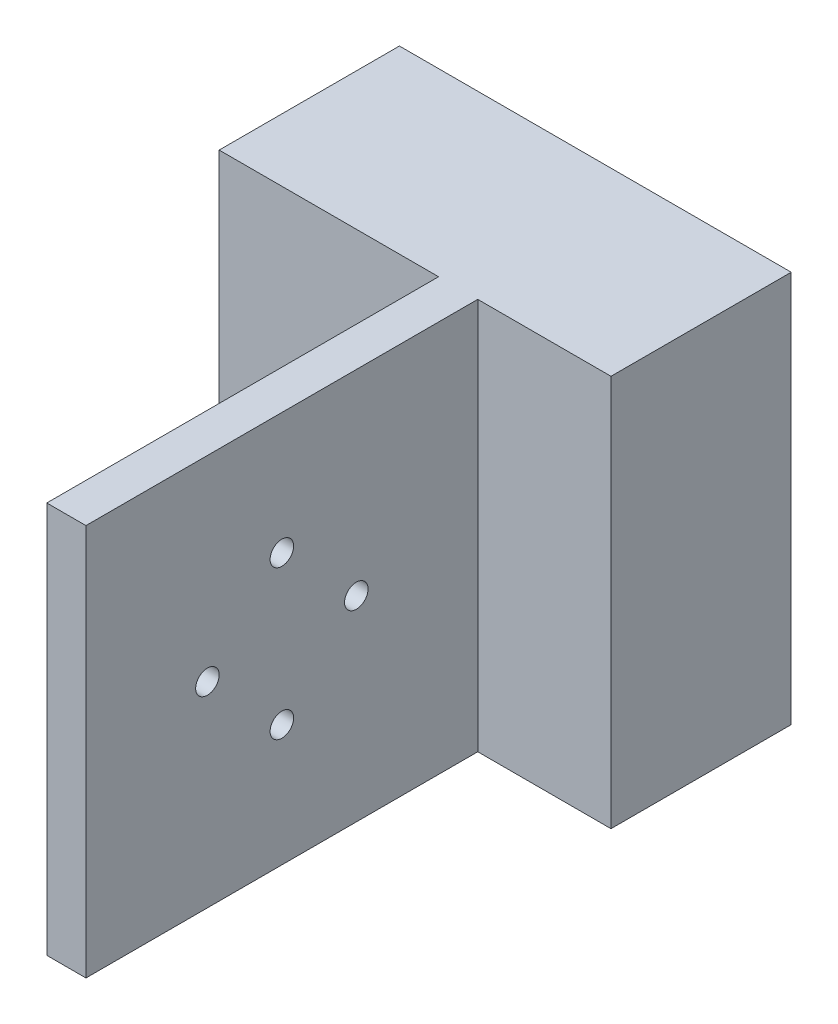
from build123d import *

# Parameters (mm, degrees)
SKETCH1_W           = 50
SKETCH1_H           = 50
SKETCH1_R           = 1.5
BOSS_EXTRUDE1_DEPTH = 5
SKETCH2_W           = 50
SKETCH2_H           = 50
BOSS_EXTRUDE2_DEPTH = 5
SKETCH3_W           = 50
SKETCH3_H           = 50
SKETCH3_R           = 6
BOSS_EXTRUDE3_DEPTH = 18


with BuildPart() as part:
    # Sketch1 → Boss-Extrude1 (new body)
    with BuildSketch(Plane(origin=(0, 0, 0), x_dir=(0, -1, 0), z_dir=(1, 0, 0))):
        Rectangle(SKETCH1_W, SKETCH1_H)
        with Locations((0, 9.5)):
            Circle(SKETCH1_R, mode=Mode.SUBTRACT)
        with Locations((9.5, 0)):
            Circle(SKETCH1_R, mode=Mode.SUBTRACT)
        with Locations((0, -9.5)):
            Circle(SKETCH1_R, mode=Mode.SUBTRACT)
        with Locations((-9.5, 0)):
            Circle(SKETCH1_R, mode=Mode.SUBTRACT)
    extrude(amount=BOSS_EXTRUDE1_DEPTH)

    # Sketch2 → Boss-Extrude2 (add)
    with BuildSketch(Plane(origin=(0, 0, -25), x_dir=(-1, 0, 0), z_dir=(0, 0, -1))):
        with Locations((3, 0)):
            Rectangle(SKETCH2_W, SKETCH2_H)
    extrude(amount=BOSS_EXTRUDE2_DEPTH)

    # Sketch3 → Boss-Extrude3 (add)
    with BuildSketch(Plane(origin=(0, 0, -30), x_dir=(-1, 0, 0), z_dir=(0, 0, -1))):
        with Locations((3, 0)):
            Rectangle(SKETCH3_W, SKETCH3_H)
        with Locations((3, 0)):
            Circle(SKETCH3_R, mode=Mode.SUBTRACT)
    extrude(amount=BOSS_EXTRUDE3_DEPTH)


solid = part.part
